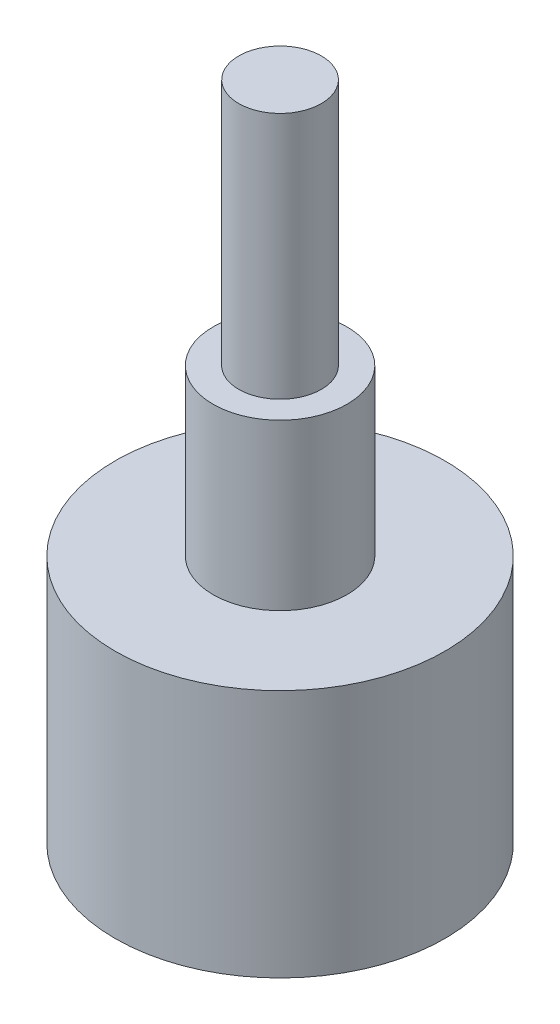
from build123d import *

# Parameters (mm, degrees)
SKETCH1_R           = 6.35
BOSS_EXTRUDE1_DEPTH = 9.58
SKETCH4_R           = 2.58
BOSS_EXTRUDE2_DEPTH = 6.35
SKETCH5_R           = 1.59
BOSS_EXTRUDE3_DEPTH = 9.53


with BuildPart() as part:
    # Sketch1 → Boss-Extrude1 (new body)
    with BuildSketch(Plane(origin=(0, 0, 0), x_dir=(1, 0, 0), z_dir=(0, 1, 0))):
        Circle(SKETCH1_R)
    extrude(amount=BOSS_EXTRUDE1_DEPTH)

    # Sketch4 → Boss-Extrude2 (add)
    with BuildSketch(Plane(origin=(0, 9.58, 0), x_dir=(1, 0, 0), z_dir=(0, 1, 0))):
        Circle(SKETCH4_R)
    extrude(amount=BOSS_EXTRUDE2_DEPTH)

    # Sketch5 → Boss-Extrude3 (add)
    with BuildSketch(Plane(origin=(0, 15.93, 0), x_dir=(1, 0, 0), z_dir=(0, 1, 0))):
        Circle(SKETCH5_R)
    extrude(amount=BOSS_EXTRUDE3_DEPTH)


solid = part.part
